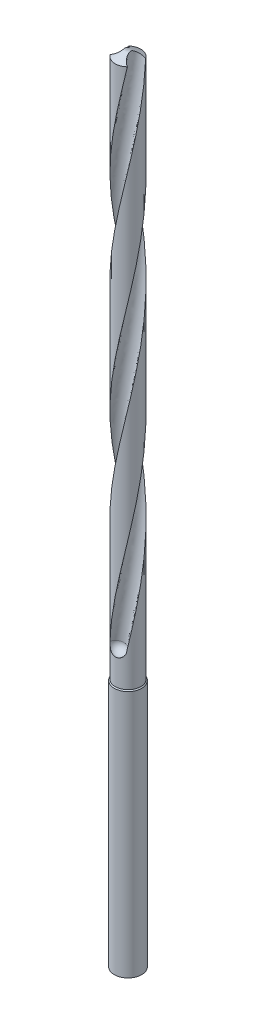
from build123d import *

# Parameters (mm, degrees)
SKETCH1_R              = 0.5905499999999999
BOSS_EXTRUDE1_DEPTH    = 25.4
CHAMFER2_SIZE2         = 0.59055
CHAMFER2_SIZE          = 0.354838239
CUT_SWEEP1_PITCH       = 19.049999999999965
CUT_SWEEP1_HEIGHT      = 23.812500000000007
CUT_SWEEP1_RADIUS      = 0.508
CUT_SWEEP1_START_ANGLE = 89.9999999999998
CUT_SWEEP1_PROFILE_R   = 0.381
CUT_SWEEP2_PITCH       = 19.04999999999996
CUT_SWEEP2_HEIGHT      = 23.812500000000007
CUT_SWEEP2_RADIUS      = 0.508
CUT_SWEEP2_START_ANGLE = -90.00000000000061
CUT_SWEEP2_PROFILE_R   = 0.381
SKETCH105_R            = 0.6350000000000001
BOSS_EXTRUDE2_DEPTH    = 11.43
CHAMFER3_SIZE          = 0.0889


# Some blends are built 0.0001 mm under size
with BuildPart() as part:
    # Sketch1 → Boss-Extrude1 (new body)
    with BuildSketch(Plane(origin=(0, 0, 0), x_dir=(1, 0, 0), z_dir=(0, 1, 0))):
        with Locations(Location((0, 0, 0), (0, 0, 270))):
            Circle(SKETCH1_R)
    extrude(amount=BOSS_EXTRUDE1_DEPTH)

    # Chamfer2
    chamfer2_edges = [part.edges().sort_by_distance(p)[0] for p in [
        (1.8e-16, 25.4, -0.5905499999999999),
    ]]
    chamfer2_side = [part.faces().sort_by_distance(p)[0] for p in [
        (1.8e-16, 25.392903235228665, -0.5905499999999999),
    ]]
    chamfer(chamfer2_edges, length=CHAMFER2_SIZE - 0.0001, length2=CHAMFER2_SIZE2 - 0.0001, reference=chamfer2_side[0])  # a hair under: the kernel refuses the full size

    # Cut-Sweep1: sweep along a helix
    with BuildLine() as cut_sweep1_path:
        add(Helix(CUT_SWEEP1_PITCH, CUT_SWEEP1_HEIGHT, CUT_SWEEP1_RADIUS, center=(0, 25.4, -1.041e-14), direction=(0, -1, 0), mode=Mode.PRIVATE).rotate(Axis((0, 25.4, -1.041e-14), (0, -1, 0)), CUT_SWEEP1_START_ANGLE))
    # Cut-Sweep1 profile (on start of the path) → Cut-Sweep1 (sweep, cut)
    with BuildSketch(Plane(origin=(0.508, 25.4, -1.21e-14), x_dir=(0, -0.1652481132319178, -0.9862520271580136), z_dir=(1.921925931895021e-14, -0.9862520271580136, 0.1652481132319178))):
        Circle(CUT_SWEEP1_PROFILE_R)
    sweep(path=cut_sweep1_path.line, is_frenet=True, mode=Mode.SUBTRACT)

    # Cut-Sweep2: sweep along a helix
    with BuildLine() as cut_sweep2_path:
        add(Helix(CUT_SWEEP2_PITCH, CUT_SWEEP2_HEIGHT, CUT_SWEEP2_RADIUS, center=(0, 25.4, -1.041e-14), direction=(0, -1, 0), mode=Mode.PRIVATE).rotate(Axis((0, 25.4, -1.041e-14), (0, -1, 0)), CUT_SWEEP2_START_ANGLE))
    # Cut-Sweep2 profile (on start of the path) → Cut-Sweep2 (sweep, cut)
    with BuildSketch(Plane(origin=(-0.508, 25.4, -5.11e-15), x_dir=(0, 0.16524811323191255, -0.9862520271580145), z_dir=(-1.1362396212821961e-14, -0.9862520271580145, -0.16524811323191255))):
        Circle(CUT_SWEEP2_PROFILE_R)
    sweep(path=cut_sweep2_path.line, is_frenet=True, mode=Mode.SUBTRACT)

    # Sketch99 → Cut-Revolve2 (revolve, cut)
    with BuildSketch(Plane(origin=(-0.25872485507192033, 1.5441502344536127, -6.94e-15), x_dir=(0.9862520271579334, 0.16524811323239766, 0), z_dir=(-0.16524811323239766, 0.9862520271579334, -4.431704066456352e-15))):
        with BuildLine():
            Line((0.6400649611478554, 0.45821705624207343), (-0.11540220163499314, 0.45821705624201264))
            ThreePointArc((-0.11540220163499314, 0.45821705624201264), (0.26233137975645776, 0.12700000000000367), (0.6400649611478554, 0.45821705624207343))
        make_face()
    revolve(axis=Axis((0.3725405103729167, 1.6499197616294616, -0.4582170562420799), (-0.9862520271579333, -0.16524811323239758, 7.957858848936075e-14)), mode=Mode.SUBTRACT)

    # Sketch100 → Cut-Revolve3 (revolve, cut)
    with BuildSketch(Plane(origin=(0.2587248550719193, 1.5441502344536062, -4e-17), x_dir=(0.9862520271579334, -0.16524811323239763, 0), z_dir=(0.16524811323239763, 0.9862520271579334, 0))):
        with BuildLine():
            Line((0.11540220163498754, -0.45821705624198633), (-0.6400649611478528, -0.45821705624201065))
            ThreePointArc((-0.6400649611478528, -0.45821705624201065), (-0.2623313797564433, -0.12699999999998968), (0.11540220163498754, -0.45821705624198633))
        make_face()
    revolve(axis=Axis((0.3725405103729143, 1.52508023837056, 0.4582170562419864), (-0.9862520271579333, 0.16524811323239763, 3.214716649525158e-14)), mode=Mode.SUBTRACT)

    # Sketch105 → Boss-Extrude2 (add)
    with BuildSketch(Plane.XZ):
        with Locations(Location((0, 0, 0), (0, 0, 270))):
            Circle(SKETCH105_R)
    extrude(amount=BOSS_EXTRUDE2_DEPTH)

    # Chamfer3
    # the kernel refuses this chamfer: 0.0889 mm, written as the material it adds along each edge
    with BuildSketch(Plane(origin=(0, 0, 0), x_dir=(-1.8e-16, 0, 1), z_dir=(-1, 0, -1.8e-16))) as chamfer3_piece_1_section:
        Polygon((0.5905499999999999 + CHAMFER3_SIZE, 0), (0.5905499999999999, CHAMFER3_SIZE), (0.5905499999999999, 0), align=None)
    chamfer3_piece_1 = revolve(axis=Axis((0, 0, 0), (0, 1, 0)), mode=Mode.PRIVATE)
    chamfer3_piece_1 = chamfer3_piece_1 & Plane(origin=(0, 0.06629689110625198, 0), x_dir=(-1.8e-16, 0, -1), z_dir=(0, 1, 0)) * Cylinder(0.6350000000000001, 3, mode=Mode.PRIVATE)
    add(chamfer3_piece_1)


solid = part.part
